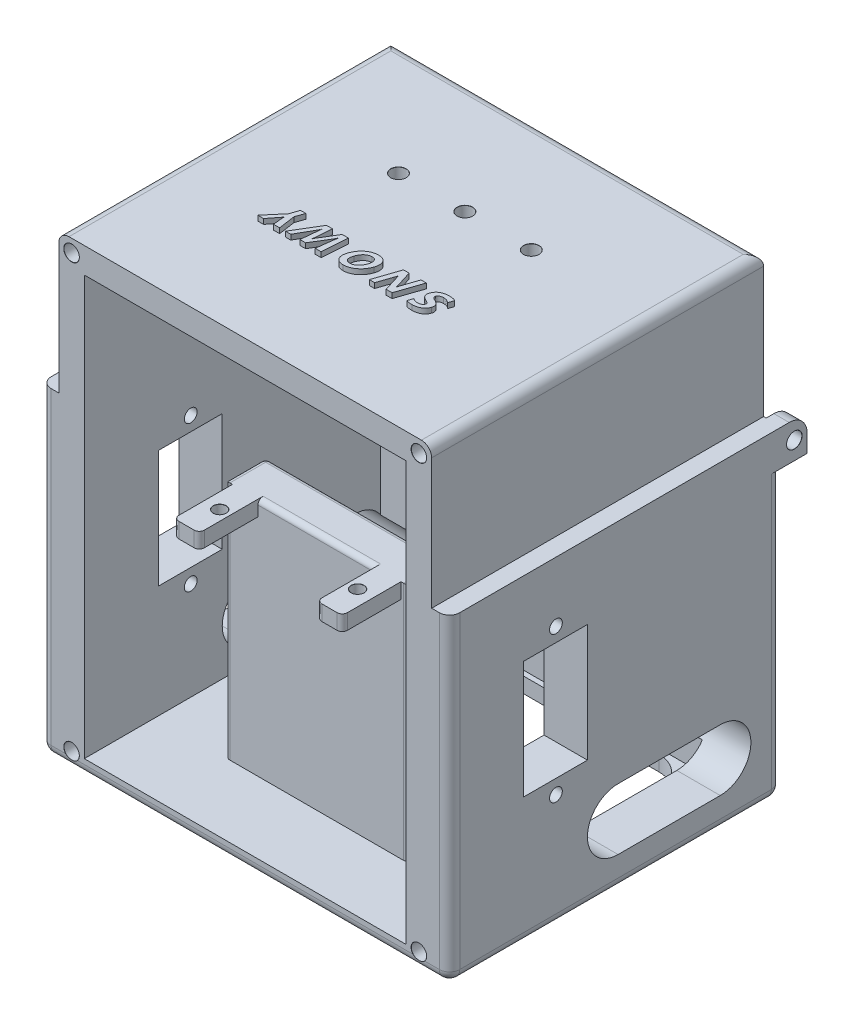
from build123d import *

# Parameters (mm, degrees)
SKETCH_1_W          = 80
SKETCH_1_H          = 90
EXTRUDE_1_DEPTH     = 7
SKETCH_2_W          = 3
SKETCH_2_H          = 7
EXTRUDE_2_DEPTH     = 5
MM_1_D              = 3
MM_1_CSINK_D        = 3.05
MM_1_CSINK_ANGLE    = 100
FILLET_1_R          = 3.5
SKETCH_9_W          = 3.5
SKETCH_9_H          = 27.5
CUT_EXTRUDE_1_DEPTH = 121.619235614
MM_2_D              = 4
MM_2_CSINK_D        = 4.05
MM_2_CSINK_ANGLE    = 100
CUT_EXTRUDE_2_DEPTH = 121.619235614
EXTRUDE_4_DEPTH     = 58
SKETCH_21_W         = 63
SKETCH_21_H         = 82
CUT_EXTRUDE_3_DEPTH = 58
SKETCH_22_W         = 12.5
SKETCH_22_H         = 23
CUT_EXTRUDE_4_DEPTH = 137.839321834
MM_3_D              = 2.5
MM_3_CSINK_D        = 2.55
MM_3_CSINK_ANGLE    = 100
MM_4_D              = 3
MM_4_CSINK_D        = 3.05
MM_4_CSINK_ANGLE    = 100
SKETCH_31_W         = 36
SKETCH_31_H         = 8
EXTRUDE_5_DEPTH     = 50
SKETCH_32_W         = 5
SKETCH_32_H         = 3
EXTRUDE_6_DEPTH     = 11.5
MM_6_D              = 2.5
MM_6_DEPTH          = 3
MM_6_CSINK_D        = 2.55
MM_6_CSINK_ANGLE    = 100
SKETCH_38_W         = 60
SKETCH_38_H         = 25
CUT_EXTRUDE_6_DEPTH = 6
FILLET_2_R          = 2
FILLET_3_R          = 2
FILLET_5_R          = 2
FILLET_7_R          = 1
MM_10_2_D           = 3
MM_10_2_CSINK_D     = 3.05
MM_10_2_CSINK_ANGLE = 100
CUT_EXTRUDE_7_DEPTH = 137.839321947
FILLET_8_R          = 6
WRAP_1_DEPTH        = 1


# Read off the part's stored shape, not the designer's step: 包覆1
with BuildPart() as part:
    # 草图1 → 凸台-拉伸1 (new body)
    with BuildSketch(Plane.XY):
        with Locations((40, 45)):
            Rectangle(SKETCH_1_W, SKETCH_1_H)
    extrude(amount=EXTRUDE_1_DEPTH)

    # 草图2 → 凸台-拉伸2 (add)
    with BuildSketch(Plane(origin=(0, 0, 0), x_dir=(-1, 0, 0), z_dir=(0, 0, -1))):
        with Locations((-78.5, 59)):
            Rectangle(SKETCH_2_W, SKETCH_2_H)
        with Locations((-56.5, 59)):
            Rectangle(SKETCH_2_W, SKETCH_2_H)
    extrude_2 = extrude(amount=EXTRUDE_2_DEPTH)

    # 镜向1: 凸台-拉伸2 across plane
    add(extrude_2.mirror(Plane(origin=(40, 0, 0), x_dir=(0, 0, 1), z_dir=(1, 0, 0))))

    # 大小mm 暗销孔1 (through all)
    with Locations(Plane(origin=(80, 0, 0), x_dir=(0, 0, -1), z_dir=(1, 0, 0))):
        with Locations((2.5, 59)):
            CounterSinkHole(MM_1_D / 2, MM_1_CSINK_D / 2, counter_sink_angle=MM_1_CSINK_ANGLE)

    # 圆角1
    fillet_1_edges = [part.edges().sort_by_distance(p)[0] for p in [
        (78.5, 62.5, -5),
        (56.5, 62.5, -5),
        (1.5, 62.5, -5),
        (23.5, 62.5, -5),
    ]]
    fillet(fillet_1_edges, radius=FILLET_1_R)

    # 草图9 → 切除-拉伸1 (cut, through all)
    with BuildSketch(Plane(origin=(0, 0, 0), x_dir=(-1, 0, 0), z_dir=(0, 0, -1))):
        with Locations((-78.25, 76.25)):
            Rectangle(SKETCH_9_W, SKETCH_9_H)
    cut_extrude_1 = extrude(amount=-CUT_EXTRUDE_1_DEPTH, mode=Mode.SUBTRACT)

    # 镜向2: 切除-拉伸1 across plane
    add(cut_extrude_1.mirror(Plane(origin=(40, 0, 0), x_dir=(0, 0, 1), z_dir=(1, 0, 0))), mode=Mode.SUBTRACT)

    # 大小mm 暗销孔2 (through all)
    with Locations(Plane(origin=(0, 0, 0), x_dir=(-1, 0, 0), z_dir=(0, 0, -1))):
        with Locations((-52, 38), (-28, 38), (-52, 6), (-28, 6)):
            CounterSinkHole(MM_2_D / 2, MM_2_CSINK_D / 2, counter_sink_angle=MM_2_CSINK_ANGLE)

    # 草图14 → 切除-拉伸2 (cut, through all)
    with BuildSketch(Plane(origin=(0, 0, 0), x_dir=(-1, 0, 0), z_dir=(0, 0, -1))):
        with BuildLine():
            Line((-34, 80), (-34, 50))
            ThreePointArc((-34, 50), (-40, 44), (-46, 50))
            Line((-46, 50), (-46, 80))
            ThreePointArc((-46, 80), (-40, 86), (-34, 80))
        make_face()
    extrude(amount=-CUT_EXTRUDE_2_DEPTH, mode=Mode.SUBTRACT)

    # 草图20 → 凸台-拉伸4 (add)
    with BuildSketch(Plane.XY.offset(7)):
        Polygon((3.5, 90), (3.5, 62.5), (0, 62.5), (0, 0), (80, 0), (80, 62.5), (76.5, 62.5), (76.5, 90), align=None)
    extrude(amount=EXTRUDE_4_DEPTH)

    # 草图21 → 切除-拉伸3 (cut)
    with BuildSketch(Plane.XY.offset(65)):
        with Locations((40, 44)):
            Rectangle(SKETCH_21_W, SKETCH_21_H)
    extrude(amount=-CUT_EXTRUDE_3_DEPTH, mode=Mode.SUBTRACT)

    # 草图22 → 切除-拉伸4 (cut, through all)
    with BuildSketch(Plane.ZY):
        with Locations((44.25, 36.5)):
            Rectangle(SKETCH_22_W, SKETCH_22_H)
    extrude(amount=-CUT_EXTRUDE_4_DEPTH, mode=Mode.SUBTRACT)

    # 大小mm 暗销孔3 (through all)
    with Locations(Plane.ZY):
        with Locations((44.169007583, 50.775449173), (44.169007583, 22.215289993)):
            CounterSinkHole(MM_3_D / 2, MM_3_CSINK_D / 2, counter_sink_angle=MM_3_CSINK_ANGLE)

    # 大小mm 暗销孔4 (through all)
    with Locations(Plane.XY.offset(65)):
        with Locations((6, 87.5), (74, 87.5), (6, 3), (74, 3)):
            CounterSinkHole(MM_4_D / 2, MM_4_CSINK_D / 2, counter_sink_angle=MM_4_CSINK_ANGLE)

    # 草图31 → 凸台-拉伸5 (add)
    with BuildSketch(Plane.XZ):
        with Locations((40, 47)):
            Rectangle(SKETCH_31_W, SKETCH_31_H)
    extrude(amount=-EXTRUDE_5_DEPTH)

    # 草图32 → 凸台-拉伸6 (add)
    with BuildSketch(Plane.XY.offset(51)):
        with Locations((26, 48.5)):
            Rectangle(SKETCH_32_W, SKETCH_32_H)
    extrude_6 = extrude(amount=EXTRUDE_6_DEPTH)

    # 镜向3: 凸台-拉伸6 across plane
    add(extrude_6.mirror(Plane.ZY.offset(-40)))

    # 大小mm 暗销孔6
    with Locations(Plane(origin=(0, 50, 0), x_dir=(1, 0, 0), z_dir=(0, 1, 0))):
        with Locations((26.5, -56.5), (53.5, -56.5)):
            CounterSinkHole(MM_6_D / 2, MM_6_CSINK_D / 2, depth=MM_6_DEPTH, counter_sink_angle=MM_6_CSINK_ANGLE)

    # 草图38 → 切除-拉伸6 (cut)
    with BuildSketch(Plane.XZ):
        with Locations((40, 20.5)):
            Rectangle(SKETCH_38_W, SKETCH_38_H)
    extrude(amount=-CUT_EXTRUDE_6_DEPTH, mode=Mode.SUBTRACT)

    # 草图43 → mm _10 (revolve, cut)
    with BuildSketch(Plane(origin=(8.5, 75, 36), x_dir=(0, 0, -1), z_dir=(0, 1, 0))):
        Polygon((0, 0), (0, 5), (6, 5), (6, 0.020977491), (6.025, 0), align=None)
    revolve(axis=Axis((14.85, 75, 36), (-1, 0, 0)), mode=Mode.SUBTRACT)

    # 草图48 → 大小mm 暗销孔9 (revolve, cut)
    with BuildSketch(Plane(origin=(65, 0, 49), x_dir=(0, 0, -1), z_dir=(1, 0, 0))):
        Polygon((0, 0), (0, 3), (6, 3), (6, 0.020977491), (6.025, 0), align=None)
    revolve(axis=Axis((65, -6.35, 49), (0, 1, 0)), mode=Mode.SUBTRACT)

    # 圆角2
    # the kernel refuses this fillet: 2 mm, written as the material it takes off along each edge
    with BuildSketch(Plane(origin=(40, 80, 7), x_dir=(-1, 0, 0), z_dir=(0, -1, 0))) as fillet_2_piece_1_section:
        with BuildLine():
            CenterArc((6 + FILLET_2_R, FILLET_2_R), FILLET_2_R, 180, 90)
            Line((6 + FILLET_2_R, 0), (6, 0))
            Line((6, 0), (6, FILLET_2_R))
        make_face()
    fillet_2_piece_1 = revolve(axis=Axis((40, 80, 7), (0, 0, -1)), revolution_arc=104.196715545, mode=Mode.PRIVATE)
    fillet_2_piece_1 = split(fillet_2_piece_1, bisect_by=Plane(origin=(34.889861728, 85, 6.47126376), z_dir=(0, -1, 0)), keep=Keep.TOP, mode=Mode.PRIVATE)
    add(fillet_2_piece_1, mode=Mode.SUBTRACT)
    with BuildSketch(Plane(origin=(34, 50, 7), x_dir=(0, 0, -1), z_dir=(0, 1, 0)), Plane(origin=(46, 80, 7), x_dir=(0, 0, -1), z_dir=(0, -1, 0))) as fillet_2_piece_2:
        with BuildLine():
            CenterArc((FILLET_2_R, FILLET_2_R), FILLET_2_R, 180, 90)
            Line((0, FILLET_2_R), (0, 0))
            Line((0, 0), (FILLET_2_R, 0))
        make_face()
    extrude(amount=30, mode=Mode.SUBTRACT)
    with BuildSketch(Plane(origin=(40, 50, 7), x_dir=(1, 0, 0), z_dir=(0, 1, 0))) as fillet_2_piece_3:
        with BuildLine():
            CenterArc((6 + FILLET_2_R, FILLET_2_R), FILLET_2_R, 180, 90)
            Line((6 + FILLET_2_R, 0), (6, 0))
            Line((6, 0), (6, FILLET_2_R))
        make_face()
    revolve(axis=Axis((40, 50, 7), (0, 0, -1)), revolution_arc=180, mode=Mode.SUBTRACT)
    with BuildSketch(Plane(origin=(40, 80, 0), x_dir=(1, 0, 0), z_dir=(0, -1, 0))) as fillet_2_piece_4:
        with BuildLine():
            CenterArc((6 + FILLET_2_R, FILLET_2_R), FILLET_2_R, 180, 90)
            Line((6, FILLET_2_R), (6, 0))
            Line((6, 0), (6 + FILLET_2_R, 0))
        make_face()
    revolve(axis=Axis((40, 80, 0), (0, 0, 1)), revolution_arc=180, mode=Mode.SUBTRACT)
    with BuildSketch(Plane(origin=(46, 50, 0), x_dir=(1, 0, 0), z_dir=(0, 1, 0)), Plane(origin=(34, 80, 0), x_dir=(-1, 0, 0), z_dir=(0, -1, 0))) as fillet_2_piece_5:
        with BuildLine():
            CenterArc((FILLET_2_R, -FILLET_2_R), FILLET_2_R, 90, 90)
            Line((0, -FILLET_2_R), (0, 0))
            Line((0, 0), (FILLET_2_R, 0))
        make_face()
    extrude(amount=30, mode=Mode.SUBTRACT)
    with BuildSketch(Plane(origin=(40, 50, 0), x_dir=(-1, 0, 0), z_dir=(0, 1, 0))) as fillet_2_piece_6:
        with BuildLine():
            CenterArc((6 + FILLET_2_R, FILLET_2_R), FILLET_2_R, 180, 90)
            Line((6, FILLET_2_R), (6, 0))
            Line((6, 0), (6 + FILLET_2_R, 0))
        make_face()
    revolve(axis=Axis((40, 50, 0), (0, 0, 1)), revolution_arc=180, mode=Mode.SUBTRACT)
    with BuildSketch(Plane(origin=(40, 80, 7), x_dir=(-0.24525181244572794, 0.9694594104407288, 0), z_dir=(-0.9694594104407288, -0.24525181244572794, 0))) as fillet_2_piece_7_section:
        with BuildLine():
            CenterArc((6 + FILLET_2_R, FILLET_2_R), FILLET_2_R, 180, 90)
            Line((6 + FILLET_2_R, 0), (6, 0))
            Line((6, 0), (6, FILLET_2_R))
        make_face()
    fillet_2_piece_7 = revolve(axis=Axis((40, 80, 7), (0, 0, -1)), revolution_arc=104.196715545, mode=Mode.PRIVATE)
    fillet_2_piece_7 = split(fillet_2_piece_7, bisect_by=Plane(origin=(45.110139176, 85, 6.471264236), z_dir=(0, -1, 0)), keep=Keep.TOP, mode=Mode.PRIVATE)
    add(fillet_2_piece_7, mode=Mode.SUBTRACT)
    with BuildSketch(Plane(origin=(0, 55.5, 0), x_dir=(1, 0, 0), z_dir=(0, -1, 0)), Plane(origin=(80, -5, 0), x_dir=(-1, 0, 0), z_dir=(0, 1, 0))) as fillet_2_piece_8:
        with BuildLine():
            CenterArc((FILLET_2_R, FILLET_2_R), FILLET_2_R, 180, 90)
            Line((0, FILLET_2_R), (0, 0))
            Line((0, 0), (FILLET_2_R, 0))
        make_face()
    extrude(amount=60.5, mode=Mode.SUBTRACT)

    # 圆角3
    # the kernel refuses this fillet: 2 mm, written as the material it takes off along each edge
    with BuildSketch(Plane(origin=(2, 0, 0), x_dir=(0, 1, 0), z_dir=(1, 0, 0))) as fillet_3_piece_1:
        with BuildLine():
            CenterArc((FILLET_3_R, FILLET_3_R), FILLET_3_R, 180, 90)
            Line((0, FILLET_3_R), (0, 0))
            Line((0, 0), (FILLET_3_R, 0))
        make_face()
    extrude(amount=76, mode=Mode.SUBTRACT)
    with BuildSketch(Plane(origin=(2, 0, 2), x_dir=(0, 0, -1), z_dir=(1, 0, 0))) as fillet_3_piece_2:
        with BuildLine():
            CenterArc((2 - FILLET_3_R, FILLET_3_R), FILLET_3_R, 270, 90)
            Line((2 - FILLET_3_R, 0), (2, 0))
            Line((2, 0), (2, FILLET_3_R))
        make_face()
    revolve(axis=Axis((2, 0, 2), (0, 1, 0)), revolution_arc=90, mode=Mode.SUBTRACT)
    with BuildSketch(Plane(origin=(78, 0, 2), x_dir=(0, 0, -1), z_dir=(-1, 0, 0))) as fillet_3_piece_3:
        with BuildLine():
            CenterArc((2 - FILLET_3_R, -FILLET_3_R), FILLET_3_R, 0, 90)
            Line((2, -FILLET_3_R), (2, 0))
            Line((2, 0), (2 - FILLET_3_R, 0))
        make_face()
    revolve(axis=Axis((78, 0, 2), (0, -1, 0)), revolution_arc=90, mode=Mode.SUBTRACT)
    with BuildSketch(Plane(origin=(80, 0, 70), x_dir=(0, 1, 0), z_dir=(0, 0, -1))) as fillet_3_piece_4:
        with BuildLine():
            CenterArc((FILLET_3_R, -FILLET_3_R), FILLET_3_R, 90, 90)
            Line((0, -FILLET_3_R), (0, 0))
            Line((0, 0), (FILLET_3_R, 0))
        make_face()
    extrude(amount=68, mode=Mode.SUBTRACT)
    with BuildSketch(Plane(origin=(0, 0, 70), x_dir=(0, 1, 0), z_dir=(0, 0, -1))) as fillet_3_piece_5:
        with BuildLine():
            CenterArc((FILLET_3_R, FILLET_3_R), FILLET_3_R, 180, 90)
            Line((0, FILLET_3_R), (0, 0))
            Line((0, 0), (FILLET_3_R, 0))
        make_face()
    extrude(amount=68, mode=Mode.SUBTRACT)

    # 圆角5
    # the kernel refuses this fillet: 2 mm, written as the material it takes off along each edge
    with BuildSketch(Plane(origin=(80, 2, 65), x_dir=(0, 0, -1), z_dir=(0, 1, 0)), Plane(origin=(0, 67.5, 65), x_dir=(0, 0, -1), z_dir=(0, -1, 0))) as fillet_5_piece_1:
        with BuildLine():
            CenterArc((FILLET_5_R, FILLET_5_R), FILLET_5_R, 180, 90)
            Line((0, FILLET_5_R), (0, 0))
            Line((0, 0), (FILLET_5_R, 0))
        make_face()
    extrude(amount=65.5, mode=Mode.SUBTRACT)
    with BuildSketch(Plane(origin=(78, 2, 65), x_dir=(0, -1, 0), z_dir=(-1, 0, 0))) as fillet_5_piece_2:
        with BuildLine():
            CenterArc((2 - FILLET_5_R, -FILLET_5_R), FILLET_5_R, 0, 90)
            Line((2, -FILLET_5_R), (2, 0))
            Line((2, 0), (2 - FILLET_5_R, 0))
        make_face()
    revolve(axis=Axis((78, 2, 65), (0, 0, 1)), revolution_arc=90, mode=Mode.SUBTRACT)
    with BuildSketch(Plane(origin=(2, 2, 65), x_dir=(-1, 0, 0), z_dir=(0, 1, 0))) as fillet_5_piece_3:
        with BuildLine():
            CenterArc((2 - FILLET_5_R, -FILLET_5_R), FILLET_5_R, 0, 90)
            Line((2, -FILLET_5_R), (2, 0))
            Line((2, 0), (2 - FILLET_5_R, 0))
        make_face()
    revolve(axis=Axis((2, 2, 65), (0, 0, 1)), revolution_arc=90, mode=Mode.SUBTRACT)
    with BuildSketch(Plane(origin=(81.5, 90, 0), x_dir=(0, -1, 0), z_dir=(-1, 0, 0))) as fillet_5_piece_4:
        with BuildLine():
            CenterArc((FILLET_5_R, FILLET_5_R), FILLET_5_R, 180, 90)
            Line((0, FILLET_5_R), (0, 0))
            Line((0, 0), (FILLET_5_R, 0))
        make_face()
    extrude(amount=83, mode=Mode.SUBTRACT)
    with BuildSketch(Plane(origin=(3.5, 90, -5), x_dir=(0, -1, 0), z_dir=(0, 0, 1)), Plane(origin=(76.5, 90, -5), x_dir=(-1, 0, 0), z_dir=(0, 0, 1))) as fillet_5_piece_5:
        with BuildLine():
            CenterArc((FILLET_5_R, FILLET_5_R), FILLET_5_R, 180, 90)
            Line((0, FILLET_5_R), (0, 0))
            Line((0, 0), (FILLET_5_R, 0))
        make_face()
    extrude(amount=75, mode=Mode.SUBTRACT)
    with BuildSketch(Plane(origin=(2, 0, 65), x_dir=(0, 0, -1), z_dir=(1, 0, 0))) as fillet_5_piece_6:
        with BuildLine():
            CenterArc((FILLET_5_R, FILLET_5_R), FILLET_5_R, 180, 90)
            Line((0, FILLET_5_R), (0, 0))
            Line((0, 0), (FILLET_5_R, 0))
        make_face()
    extrude(amount=76, mode=Mode.SUBTRACT)

    # 圆角7
    fillet_7_edges = [part.edges().sort_by_distance(p)[0] for p in [
        (56.5, 48.5, 62.5),
        (51.5, 48.5, 62.5),
        (28.5, 48.5, 62.5),
        (23.5, 48.5, 62.5),
        (22, 26.5, 43),
        (22, 50, 47),
        (40, 50, 43),
        (58, 50, 47),
        (58, 26.5, 43),
        (40, 50, 51),
        (22, 26.5, 51),
        (58, 26.5, 51),
    ]]
    fillet(fillet_7_edges, radius=FILLET_7_R)

    # mm _10 2 (through all)
    with Locations(Plane(origin=(0, 90, 0), x_dir=(1, 0, 0), z_dir=(0, 1, 0))):
        with Locations((27, -22), (40, -22), (53, -22)):
            CounterSinkHole(MM_10_2_D / 2, MM_10_2_CSINK_D / 2, counter_sink_angle=MM_10_2_CSINK_ANGLE)

    # 草图52 → 切除-拉伸7 (cut, through all)
    with BuildSketch(Plane.ZY):
        with BuildLine():
            Line((12, 18), (32, 18))
            ThreePointArc((32, 18), (38, 12), (32, 6))
            Line((32, 6), (12, 6))
            ThreePointArc((12, 6), (6, 12), (12, 18))
        make_face()
    extrude(amount=-CUT_EXTRUDE_7_DEPTH, mode=Mode.SUBTRACT)

    # 圆角8
    fillet_8_edges = [part.edges().sort_by_distance(p)[0] for p in [
        (10, 1.5, 8),
        (10, 1.5, 33),
        (70, 1.5, 33),
        (70, 1.5, 8),
    ]]
    fillet(fillet_8_edges, radius=FILLET_8_R)

    # 包覆1 outline → 包覆1 (add)
    # profile 1 of 5: a face of its own
    with BuildSketch(Plane(origin=(0, 90, 0), x_dir=(1, 0, 0), z_dir=(0, 1, 0))):
        with BuildLine():
            add(Edge.make_bspline(
                [(24.229230183, -41.938262195), (24.22885128, -41.931912339), (24.227904732, -41.916049584), (24.228259365, -41.888074654), (24.229168456, -41.851233061), (24.231484743, -41.805844345), (24.232676912, -41.751159742), (24.237357515, -41.688035342), (24.240418344, -41.615863677), (24.244310717, -41.565094399), (24.246379573, -41.538109756)],
                knots=[0, 0, 0, 0, 0.047615924, 0.118950698, 0.20933936, 0.323574032, 0.459193509, 0.618791504, 0.797381893, 1, 1, 1, 1], degree=3))
            Line((24.229230183, -41.938262195), (24.405487805, -43.87804878))
            Line((24.405487805, -43.87804878), (25.617378049, -43.87804878))
            Line((25.617378049, -43.87804878), (25.141958841, -40.612042683))
            Line((25.141958841, -40.612042683), (25.731707317, -38.87804878))
            Line((25.731707317, -38.87804878), (24.695121951, -38.87804878))
            Line((24.695121951, -38.87804878), (24.099657012, -40.631097561))
            Line((24.099657012, -40.631097561), (21.349085366, -43.87804878))
            Line((21.349085366, -43.87804878), (22.474275915, -43.87804878))
            Line((22.474275915, -43.87804878), (23.995807927, -41.927782012))
            add(Edge.make_bspline(
                [(24.233993902, -41.538109756), (24.214539008, -41.57507552), (24.176792494, -41.646796739), (24.118078745, -41.748951268), (24.057700891, -41.841729137), (24.016029564, -41.899666861), (23.995807927, -41.927782012)],
                knots=[0, 0, 0, 0, 0.274077436, 0.531766849, 0.772782823, 1, 1, 1, 1], degree=3))
            Line((24.233993902, -41.538109756), (24.246379573, -41.538109756))
        make_face()
    # profile 2 of 5: a face of its own
    with BuildSketch(Plane(origin=(0, 90, 0), x_dir=(1, 0, 0), z_dir=(0, 1, 0))):
        with BuildLine():
            add(Edge.make_bspline(
                [(30.702172256, -42.137385671), (30.697446618, -42.181888177), (30.687830548, -42.272445098), (30.666470242, -42.409497274), (30.634181319, -42.548740915), (30.608499746, -42.64179456), (30.595464939, -42.68902439)],
                knots=[0, 0, 0, 0, 0.238551625, 0.485422122, 0.738823499, 1, 1, 1, 1], degree=3))
            Line((30.702172256, -42.137385671), (30.963224085, -38.87804878))
            Line((30.963224085, -38.87804878), (29.785632622, -38.87804878))
            Line((29.785632622, -38.87804878), (26.760670732, -43.87804878))
            Line((26.760670732, -43.87804878), (27.797256098, -43.87804878))
            Line((27.797256098, -43.87804878), (29.740853659, -40.478658537))
            add(Edge.make_bspline(
                [(30.008574695, -39.929878049), (29.969684795, -40.023152325), (29.891224275, -40.211333528), (29.791266274, -40.389036287), (29.740853659, -40.478658537)],
                knots=[0, 0, 0, 0, 0.495662025, 1, 1, 1, 1], degree=3))
            Line((30.008574695, -39.929878049), (30.024771341, -39.929878049))
            add(Edge.make_bspline(
                [(29.923780488, -40.459603659), (29.927894761, -40.42303679), (29.93672653, -40.344541728), (29.95825283, -40.219625005), (29.988104728, -40.079626538), (30.012111859, -39.98158008), (30.024771341, -39.929878049)],
                knots=[0, 0, 0, 0, 0.204493351, 0.438968913, 0.704156097, 1, 1, 1, 1], degree=3))
            Line((29.923780488, -40.459603659), (29.591272866, -43.87804878))
            Line((29.591272866, -43.87804878), (30.704077744, -43.87804878))
            Line((30.704077744, -43.87804878), (32.764862805, -40.50152439))
            add(Edge.make_bspline(
                [(33.059260671, -39.923208841), (33.040323327, -39.968501442), (33.001108558, -40.062291728), (32.931742602, -40.203568166), (32.854113154, -40.351994204), (32.79521411, -40.450673763), (32.764862805, -40.50152439)],
                knots=[0, 0, 0, 0, 0.226670032, 0.469380135, 0.726565932, 1, 1, 1, 1], degree=3))
            Line((33.059260671, -39.923208841), (33.12023628, -39.923208841))
            add(Edge.make_bspline(
                [(32.996379573, -40.485327744), (33.002024722, -40.445564278), (33.014044431, -40.3608995), (33.041599192, -40.227543051), (33.076781965, -40.079774518), (33.10527701, -39.977107018), (33.12023628, -39.923208841)],
                knots=[0, 0, 0, 0, 0.209096403, 0.445210199, 0.708747574, 1, 1, 1, 1], degree=3))
            Line((32.996379573, -40.485327744), (32.575266768, -43.87804878))
            Line((32.575266768, -43.87804878), (33.727134146, -43.87804878))
            Line((33.727134146, -43.87804878), (34.093940549, -38.87804878))
            Line((34.093940549, -38.87804878), (32.864900915, -38.87804878))
            Line((32.864900915, -38.87804878), (30.885099085, -42.137385671))
            add(Edge.make_bspline(
                [(30.608803354, -42.68902439), (30.632234108, -42.63549043), (30.677309461, -42.532503471), (30.748219598, -42.387492122), (30.81483405, -42.255959589), (30.86246099, -42.175587995), (30.885099085, -42.137385671)],
                knots=[0, 0, 0, 0, 0.283907735, 0.546172826, 0.784286316, 1, 1, 1, 1], degree=3))
            Line((30.608803354, -42.68902439), (30.595464939, -42.68902439))
        make_face()
    # profile 3 of 5: a face of its own
    with BuildSketch(Plane(origin=(0, 90, 0), x_dir=(1, 0, 0), z_dir=(0, 1, 0))):
        with BuildLine():
            add(Edge.make_bspline(
                [(38.098323171, -43.93902439), (38.054478925, -43.938532527), (37.968609268, -43.937569204), (37.842145854, -43.928317452), (37.72089793, -43.915737908), (37.604527804, -43.896337419), (37.493434552, -43.87189397), (37.387386295, -43.841539733), (37.287076451, -43.804919877), (37.191358278, -43.76415212), (37.100766345, -43.717604124), (37.015543885, -43.66483), (36.935263381, -43.606591105), (36.860116507, -43.542868646), (36.790091212, -43.473731223), (36.725071175, -43.399484271), (36.665972579, -43.318869191), (36.611938461, -43.233509722), (36.563285211, -43.143726923), (36.520391601, -43.050567934), (36.484089798, -42.954095649), (36.454565248, -42.854353769), (36.430905227, -42.751551201), (36.412610905, -42.645687418), (36.401053046, -42.536516568), (36.397169341, -42.424210614), (36.396133453, -42.308753719), (36.404646614, -42.190497827), (36.4180097, -42.069099197), (36.436811459, -41.944377988), (36.463006366, -41.816748089), (36.494372142, -41.685714373), (36.532526808, -41.551683347), (36.561885022, -41.461796875), (36.576791159, -41.416158537)],
                knots=[0, 0, 0, 0, 0.036499102, 0.071484077, 0.105532167, 0.137961563, 0.169653831, 0.200200214, 0.229727009, 0.25851036, 0.28677527, 0.314440114, 0.341890562, 0.369281087, 0.39639323, 0.423755661, 0.451362313, 0.479531824, 0.507810336, 0.536325225, 0.564859724, 0.593555491, 0.62286839, 0.652646311, 0.682957166, 0.71418717, 0.746182447, 0.779039162, 0.812824409, 0.847865298, 0.8840102, 0.92127238, 0.960027381, 1, 1, 1, 1], degree=3))
            add(Edge.make_bspline(
                [(41.48913872, -41.314214939), (41.454562429, -41.409377039), (41.386100456, -41.597800525), (41.261301888, -41.869010168), (41.120341, -42.126612568), (40.96240927, -42.37111683), (40.787018826, -42.601524657), (40.594765262, -42.818814853), (40.385467767, -43.021867038), (40.161844283, -43.210583504), (39.926917722, -43.38156358), (39.683772479, -43.530891536), (39.433851527, -43.655946861), (39.178892753, -43.759580035), (38.917510287, -43.840125117), (38.65001966, -43.896995827), (38.376216194, -43.932613324), (38.191482465, -43.93687518), (38.098323171, -43.93902439)],
                knots=[0, 0, 0, 0, 0.066355595, 0.131385842, 0.195492294, 0.258729343, 0.322024633, 0.385151907, 0.448758047, 0.513030966, 0.576832402, 0.639071376, 0.699873268, 0.759839182, 0.819308584, 0.878929046, 0.938945179, 1, 1, 1, 1], degree=3))
            add(Edge.make_bspline(
                [(39.919969512, -38.817073171), (39.963800586, -38.817736435), (40.050257978, -38.819044733), (40.177240171, -38.825933499), (40.299170116, -38.841088286), (40.416071015, -38.859290833), (40.528107087, -38.884802748), (40.635373039, -38.913357391), (40.737291864, -38.949391529), (40.834400469, -38.989687474), (40.92608918, -39.037320797), (41.013940397, -39.087666959), (41.095352683, -39.146098641), (41.172838325, -39.208275979), (41.243967172, -39.277914641), (41.312378092, -39.350398672), (41.373129536, -39.430806629), (41.430134097, -39.514856694), (41.481761578, -39.603490481), (41.526482048, -39.695934705), (41.564416906, -39.79163134), (41.597231723, -39.889767546), (41.622580283, -39.991466951), (41.643311159, -40.09596564), (41.654467221, -40.204079864), (41.66326313, -40.31494832), (41.662344708, -40.429204283), (41.656609432, -40.546476727), (41.645712945, -40.667154677), (41.625475648, -40.790493953), (41.602730493, -40.917714891), (41.570271955, -41.04703976), (41.533558533, -41.180094073), (41.504140024, -41.268920108), (41.48913872, -41.314214939)],
                knots=[0, 0, 0, 0, 0.036491508, 0.071979998, 0.105788204, 0.138732624, 0.170418297, 0.201395728, 0.231076935, 0.260340777, 0.288835019, 0.317037107, 0.344542894, 0.372165318, 0.39965077, 0.427340163, 0.455048481, 0.483424745, 0.511855143, 0.540350612, 0.568823999, 0.597499175, 0.626417056, 0.656022816, 0.686093527, 0.716833146, 0.748557396, 0.781113418, 0.814574608, 0.849346889, 0.885123709, 0.922121169, 0.960287448, 1, 1, 1, 1], degree=3))
            add(Edge.make_bspline(
                [(36.576791159, -41.416158537), (36.611015368, -41.321301734), (36.678675472, -41.133773045), (36.802743482, -40.864229622), (36.942722674, -40.608513632), (37.099492307, -40.366303022), (37.273414843, -40.138229133), (37.463555959, -39.923342819), (37.66972752, -39.721534705), (37.891740636, -39.535938492), (38.124680319, -39.368409225), (38.364214073, -39.220485686), (38.610131596, -39.09634148), (38.86129368, -38.993638067), (39.118313129, -38.914375091), (39.380642492, -38.858038432), (39.648480462, -38.823789928), (39.829041941, -38.819322758), (39.919969512, -38.817073171)],
                knots=[0, 0, 0, 0, 0.066931855, 0.132322013, 0.196776627, 0.260353294, 0.323698746, 0.38703753, 0.45070924, 0.515073767, 0.578978294, 0.641073202, 0.701804064, 0.761675528, 0.821036842, 0.880138044, 0.939639636, 1, 1, 1, 1], degree=3))
        make_face()
        with BuildLine():
            add(Edge.make_bspline(
                [(39.590320122, -39.731707317), (39.537842824, -39.732863397), (39.434045823, -39.735150054), (39.280711587, -39.757218227), (39.131721276, -39.791189018), (38.98658221, -39.839378677), (38.845372827, -39.901168689), (38.708760763, -39.97829675), (38.576000966, -40.067891664), (38.448713269, -40.171074048), (38.327161496, -40.285137664), (38.212516245, -40.40904718), (38.106632138, -40.54315404), (38.00834595, -40.686420017), (37.917691953, -40.839224474), (37.835262331, -41.001436994), (37.758803247, -41.172377248), (37.716716627, -41.291660454), (37.6953125, -41.352324695)],
                knots=[0, 0, 0, 0, 0.05899407, 0.116686793, 0.173877464, 0.230697667, 0.288440135, 0.346972759, 0.406914194, 0.468393148, 0.531068454, 0.594266858, 0.658089119, 0.723088164, 0.789558647, 0.857776158, 0.927668767, 1, 1, 1, 1], degree=3))
            add(Edge.make_bspline(
                [(40.372522866, -41.371379573), (40.391473382, -41.312870061), (40.428232265, -41.19937741), (40.467744368, -41.030419433), (40.495316794, -40.870133103), (40.508202521, -40.718041486), (40.50631346, -40.574167061), (40.491762466, -40.438282243), (40.462023132, -40.310313491), (40.418648392, -40.191322371), (40.361723834, -40.083284189), (40.291645528, -39.987786409), (40.206505205, -39.908331645), (40.109109085, -39.842197335), (39.997452163, -39.79309485), (39.873665913, -39.756554835), (39.73611844, -39.736183808), (39.640245069, -39.733240178), (39.590320122, -39.731707317)],
                knots=[0, 0, 0, 0, 0.083316248, 0.161611016, 0.234914324, 0.303575078, 0.368139688, 0.429642156, 0.488418707, 0.545744982, 0.600809995, 0.653404238, 0.705467499, 0.757871208, 0.812191104, 0.870070492, 0.932340714, 1, 1, 1, 1], degree=3))
            add(Edge.make_bspline(
                [(38.44226372, -43.024390244), (38.494723894, -43.022755941), (38.59910221, -43.019504222), (38.753728564, -42.998600213), (38.904453132, -42.961723636), (39.051598363, -42.911253117), (39.195209524, -42.845727061), (39.335448022, -42.766795992), (39.471349568, -42.672317948), (39.602899852, -42.564992648), (39.728998844, -42.446857511), (39.846345352, -42.318189456), (39.956562482, -42.181889658), (40.056916076, -42.036326993), (40.149144837, -41.882591778), (40.232767533, -41.720614173), (40.308583559, -41.549883355), (40.351032967, -41.431374409), (40.372522866, -41.371379573)],
                knots=[0, 0, 0, 0, 0.058032156, 0.115464709, 0.172210924, 0.22942496, 0.287281407, 0.346585147, 0.407195905, 0.470126198, 0.534245426, 0.598143896, 0.662608637, 0.727996204, 0.793544941, 0.860792469, 0.929526562, 1, 1, 1, 1], degree=3))
            add(Edge.make_bspline(
                [(37.6953125, -41.352324695), (37.674747543, -41.414951088), (37.635095025, -41.535704768), (37.591833517, -41.71456484), (37.560264223, -41.882695557), (37.543714818, -42.041071218), (37.541281978, -42.189718378), (37.553197968, -42.328436848), (37.579720179, -42.457125368), (37.620201908, -42.575171336), (37.675931793, -42.680561055), (37.743805134, -42.773930991), (37.827209363, -42.852358385), (37.924895906, -42.915115363), (38.035079452, -42.965560439), (38.159157005, -43.000020343), (38.296397083, -43.021220395), (38.392320157, -43.023304913), (38.44226372, -43.024390244)],
                knots=[0, 0, 0, 0, 0.088009086, 0.169695563, 0.245575333, 0.316357627, 0.382111126, 0.443864045, 0.501931904, 0.557202518, 0.60995124, 0.660599566, 0.71071218, 0.76189061, 0.815040314, 0.871965948, 0.933337451, 1, 1, 1, 1], degree=3))
        make_face(mode=Mode.SUBTRACT)
    # profile 4 of 5: a face of its own
    with BuildSketch(Plane(origin=(0, 90, 0), x_dir=(1, 0, 0), z_dir=(0, 1, 0))):
        with BuildLine():
            add(Edge.make_bspline(
                [(46.9921875, -42.112614329), (47.004416708, -42.152580243), (47.027534206, -42.228129853), (47.057728121, -42.335520149), (47.078985568, -42.431341948), (47.088668405, -42.491442915), (47.093178354, -42.519435976)],
                knots=[0, 0, 0, 0, 0.298803714, 0.564843945, 0.797318569, 1, 1, 1, 1], degree=3))
            Line((46.9921875, -42.112614329), (45.970846037, -38.87804878))
            Line((45.970846037, -38.87804878), (44.87804878, -38.87804878))
            Line((44.87804878, -38.87804878), (43.178353659, -43.87804878))
            Line((43.178353659, -43.87804878), (44.214939024, -43.87804878))
            Line((44.214939024, -43.87804878), (45.183879573, -41.027439024))
            add(Edge.make_bspline(
                [(45.362042683, -40.336699695), (45.361056496, -40.353562092), (45.358868412, -40.390975246), (45.348396394, -40.451601854), (45.33399758, -40.522416695), (45.314917611, -40.6035243), (45.289972147, -40.694985724), (45.259080952, -40.79673157), (45.2242968, -40.909104259), (45.19774086, -40.986855534), (45.183879573, -41.027439024)],
                knots=[0, 0, 0, 0, 0.070812019, 0.157112951, 0.257707227, 0.374044177, 0.506551476, 0.655344719, 0.820101801, 1, 1, 1, 1], degree=3))
            Line((45.362042683, -40.336699695), (45.378239329, -40.336699695))
            add(Edge.make_bspline(
                [(45.491615854, -40.733993902), (45.484027661, -40.709212242), (45.469528048, -40.661859133), (45.448292759, -40.594394605), (45.430398757, -40.533671029), (45.414975723, -40.480362821), (45.402747935, -40.43418309), (45.392032286, -40.39558017), (45.384441827, -40.363728685), (45.38013464, -40.344959002), (45.378239329, -40.336699695)],
                knots=[0, 0, 0, 0, 0.188143138, 0.359506277, 0.513418314, 0.647688376, 0.762335543, 0.860200827, 0.93848355, 1, 1, 1, 1], degree=3))
            Line((45.491615854, -40.733993902), (46.466272866, -43.87804878))
            Line((46.466272866, -43.87804878), (47.629573171, -43.87804878))
            Line((47.629573171, -43.87804878), (49.329268293, -38.87804878))
            Line((49.329268293, -38.87804878), (48.292682927, -38.87804878))
            Line((48.292682927, -38.87804878), (47.32660061, -41.721989329))
            add(Edge.make_bspline(
                [(47.109375, -42.519435976), (47.112669818, -42.496536457), (47.119743979, -42.447369885), (47.135429133, -42.369584512), (47.155094472, -42.282671254), (47.181915127, -42.187914914), (47.209510717, -42.083511006), (47.244682119, -41.971092111), (47.283359283, -41.849329096), (47.311842681, -41.765449404), (47.32660061, -41.721989329)],
                knots=[0, 0, 0, 0, 0.083844234, 0.180018353, 0.287525799, 0.406762549, 0.536903185, 0.678919366, 0.833640447, 1, 1, 1, 1], degree=3))
            Line((47.109375, -42.519435976), (47.093178354, -42.519435976))
        make_face()
    # profile 5 of 5: a face of its own
    with BuildSketch(Plane(origin=(0, 90, 0), x_dir=(1, 0, 0), z_dir=(0, 1, 0))):
        with BuildLine():
            add(Edge.make_bspline(
                [(53.535632622, -39.670731707), (53.465977943, -39.672428554), (53.333370842, -39.675658975), (53.144348681, -39.703423641), (52.975554043, -39.748773636), (52.828710222, -39.814692047), (52.705266881, -39.895258878), (52.602249765, -39.984768405), (52.524675168, -40.088443256), (52.492192377, -40.165388666), (52.476181402, -40.203315549)],
                knots=[0, 0, 0, 0, 0.16544916, 0.314978605, 0.452855601, 0.579522049, 0.695697629, 0.802055276, 0.902431784, 1, 1, 1, 1], degree=3))
            add(Edge.make_bspline(
                [(54.747522866, -40.158536585), (54.709992935, -40.119457005), (54.635454261, -40.041840553), (54.508263478, -39.94305596), (54.37197327, -39.857895688), (54.224537783, -39.789654907), (54.066851421, -39.735715057), (53.898783978, -39.698294278), (53.720494754, -39.674788751), (53.598272147, -39.672106415), (53.535632622, -39.670731707)],
                knots=[0, 0, 0, 0, 0.120518494, 0.239363315, 0.357507479, 0.477733046, 0.600290588, 0.727933526, 0.860564954, 1, 1, 1, 1], degree=3))
            Line((54.747522866, -40.158536585), (55.109565549, -39.093368902))
            add(Edge.make_bspline(
                [(53.802400915, -38.817073171), (53.871646621, -38.818126612), (54.005805428, -38.820167581), (54.200843095, -38.831897185), (54.383229351, -38.854444937), (54.553504498, -38.882601713), (54.710992312, -38.922187041), (54.855961723, -38.969599836), (54.989323143, -39.024727523), (55.070285655, -39.070945648), (55.109565549, -39.093368902)],
                knots=[0, 0, 0, 0, 0.153682975, 0.297750225, 0.43333615, 0.561370115, 0.680511702, 0.7932857, 0.899710179, 1, 1, 1, 1], degree=3))
            add(Edge.make_bspline(
                [(51.35003811, -40.288109756), (51.371122989, -40.229516607), (51.412710192, -40.113949184), (51.494206245, -39.950815507), (51.585872466, -39.797341848), (51.689212821, -39.65396721), (51.80699204, -39.523155755), (51.934851761, -39.401023026), (52.076178957, -39.2907552), (52.229485738, -39.191550692), (52.39305446, -39.102884498), (52.56705609, -39.027033154), (52.750026853, -38.961821648), (52.942338918, -38.908657408), (53.14425085, -38.867886345), (53.355201798, -38.838703377), (53.575624817, -38.819928728), (53.725824753, -38.818037415), (53.802400915, -38.817073171)],
                knots=[0, 0, 0, 0, 0.060782891, 0.119886406, 0.177771586, 0.235294013, 0.292204178, 0.349478453, 0.407814108, 0.46701443, 0.527673694, 0.589348586, 0.652244912, 0.717274047, 0.784077128, 0.853308246, 0.925212409, 1, 1, 1, 1], degree=3))
            add(Edge.make_bspline(
                [(52.135099085, -41.804878049), (52.08425028, -41.778837546), (51.986216415, -41.728632805), (51.850270729, -41.645845442), (51.727336199, -41.564740831), (51.620366741, -41.480832536), (51.528217282, -41.395793581), (51.450316165, -41.310210206), (51.387452177, -41.223184501), (51.339812329, -41.133886131), (51.305439253, -41.041694397), (51.280406422, -40.946292524), (51.266206127, -40.846259749), (51.262478318, -40.742482701), (51.269843448, -40.634452995), (51.28586914, -40.522235404), (51.312822149, -40.405736201), (51.337427295, -40.327968068), (51.35003811, -40.288109756)],
                knots=[0, 0, 0, 0, 0.08908071, 0.171742998, 0.248133565, 0.318692729, 0.383541418, 0.443522681, 0.498920545, 0.550556079, 0.600882344, 0.6520668, 0.704118871, 0.758151057, 0.813741279, 0.872799, 0.934805981, 1, 1, 1, 1], degree=3))
            add(Edge.make_bspline(
                [(52.828696646, -42.574695122), (52.83714435, -42.544463436), (52.85348321, -42.485991775), (52.853399924, -42.395042177), (52.830607788, -42.308528797), (52.793923091, -42.239858164), (52.749734733, -42.185696563), (52.70125326, -42.141972862), (52.641084681, -42.092833789), (52.566239337, -42.04173442), (52.477081175, -41.988098448), (52.375594655, -41.92878477), (52.260129169, -41.867049219), (52.178084392, -41.826252479), (52.135099085, -41.804878049)],
                knots=[0, 0, 0, 0, 0.082145578, 0.158879281, 0.235549495, 0.315030832, 0.361274285, 0.418509415, 0.486114756, 0.565240823, 0.656218597, 0.759362764, 0.873924144, 1, 1, 1, 1], degree=3))
            add(Edge.make_bspline(
                [(51.803544207, -43.085365854), (51.865869582, -43.083770099), (51.986954547, -43.080669885), (52.161754748, -43.055369397), (52.322601366, -43.010751002), (52.446626569, -42.961191998), (52.536447857, -42.912602082), (52.596863051, -42.873251218), (52.651748749, -42.8313142), (52.699971162, -42.78601136), (52.741968225, -42.737543997), (52.77665315, -42.686008626), (52.807495459, -42.632405084), (52.821607124, -42.593992911), (52.828696646, -42.574695122)],
                knots=[0, 0, 0, 0, 0.153563453, 0.298341175, 0.433913561, 0.564139258, 0.62647771, 0.685307683, 0.741664805, 0.796479113, 0.848093304, 0.89932631, 0.949422813, 1, 1, 1, 1], degree=3))
            add(Edge.make_bspline(
                [(50.767911585, -42.719512195), (50.799631891, -42.748913667), (50.863178607, -42.80781496), (50.9710665, -42.881655749), (51.087096206, -42.945240602), (51.212761311, -42.996667005), (51.347512861, -43.036507777), (51.491340106, -43.064903935), (51.644324342, -43.082316453), (51.749507705, -43.084330939), (51.803544207, -43.085365854)],
                knots=[0, 0, 0, 0, 0.114963019, 0.230310593, 0.346795018, 0.466544807, 0.590882884, 0.72016346, 0.856237837, 1, 1, 1, 1], degree=3))
            Line((50.767911585, -42.719512195), (50.419207317, -43.74371189))
            add(Edge.make_bspline(
                [(51.561547256, -43.93902439), (51.503097266, -43.938598001), (51.389290067, -43.937767784), (51.223079656, -43.927797347), (51.066055072, -43.912808421), (50.918058597, -43.892355523), (50.779782284, -43.864537419), (50.650716508, -43.831625191), (50.53096678, -43.791774296), (50.455844829, -43.759467934), (50.419207317, -43.74371189)],
                knots=[0, 0, 0, 0, 0.150177454, 0.292408528, 0.427692226, 0.55545137, 0.676125414, 0.789937662, 0.897551099, 1, 1, 1, 1], degree=3))
            add(Edge.make_bspline(
                [(53.953887195, -42.494664634), (53.933367613, -42.550695456), (53.892710391, -42.661714173), (53.813318899, -42.819025993), (53.723215254, -42.967670826), (53.618119113, -43.105578327), (53.500741192, -43.2346539), (53.369919719, -43.353891324), (53.225683081, -43.462876555), (53.070312625, -43.562420362), (52.904620631, -43.650547161), (52.731963482, -43.727509895), (52.553245362, -43.794432885), (52.366959676, -43.845480482), (52.175111806, -43.888428959), (51.976355037, -43.917124059), (51.771206505, -43.936150398), (51.632094752, -43.938057331), (51.561547256, -43.93902439)],
                knots=[0, 0, 0, 0, 0.05984695, 0.118579941, 0.176530063, 0.234099321, 0.292315351, 0.351432022, 0.411488288, 0.473562114, 0.536452308, 0.5996624, 0.663199576, 0.727783616, 0.793372261, 0.860407405, 0.929208656, 1, 1, 1, 1], degree=3))
            add(Edge.make_bspline(
                [(53.270769817, -41.073170732), (53.311086696, -41.09358024), (53.38956341, -41.133307301), (53.499053373, -41.200401155), (53.598923733, -41.270060609), (53.688508683, -41.34291746), (53.76739335, -41.419924951), (53.836510178, -41.499872877), (53.894795359, -41.583965611), (53.943079, -41.671728918), (53.981307137, -41.762622066), (54.008084535, -41.857737579), (54.025303048, -41.955711879), (54.031977365, -42.057301465), (54.027456713, -42.162184532), (54.01476078, -42.270466573), (53.98897652, -42.382054518), (53.965815566, -42.456383612), (53.953887195, -42.494664634)],
                knots=[0, 0, 0, 0, 0.076998171, 0.149876769, 0.218659597, 0.284437152, 0.346451775, 0.406341416, 0.464304039, 0.520511055, 0.576809233, 0.63198228, 0.688584136, 0.746089954, 0.805134492, 0.867309568, 0.931661682, 1, 1, 1, 1], degree=3))
            add(Edge.make_bspline(
                [(52.476181402, -40.203315549), (52.466917293, -40.236390368), (52.448966032, -40.300480142), (52.449778649, -40.400323182), (52.472346041, -40.496597037), (52.509903481, -40.574947217), (52.55827728, -40.636986533), (52.612520937, -40.687237532), (52.681352885, -40.743145714), (52.768491533, -40.800073842), (52.869765426, -40.864689757), (52.989243346, -40.930153311), (53.124109644, -41.001231216), (53.220143154, -41.048337421), (53.270769817, -41.073170732)],
                knots=[0, 0, 0, 0, 0.078935292, 0.152954577, 0.227440408, 0.305774644, 0.351218134, 0.408231013, 0.475988262, 0.555668499, 0.64818952, 0.753183667, 0.869884094, 1, 1, 1, 1], degree=3))
        make_face()
    extrude(amount=WRAP_1_DEPTH)


solid = part.part
